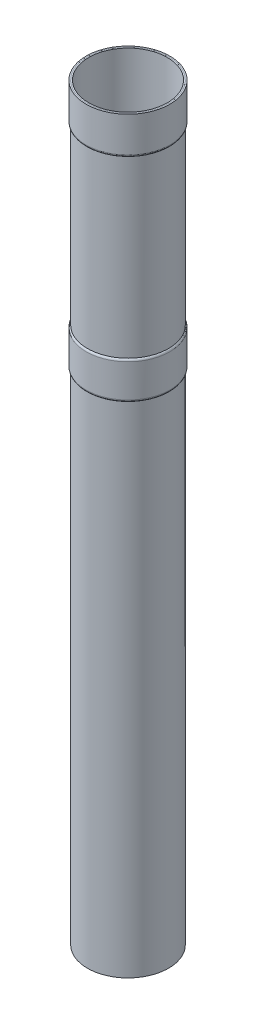
from build123d import *

# Parameters (mm, degrees)
ESBO_O1_R                = 32.5
ESBO_O1_R_2              = 31.5
RESSALTO_EXTRUS_O1_DEPTH = 600
ESBO_O2_R                = 33.5
ESBO_O2_R_2              = 32.5
RESSALTO_EXTRUS_O2_DEPTH = 30
ESBO_O4_R                = 33.5
ESBO_O4_R_2              = 32.5
RESSALTO_EXTRUS_O3_DEPTH = 430
ESBO_O5_R                = 33.5
ESBO_O5_R_2              = 32.5
CORTE_EXTRUS_O1_DEPTH    = 400
FILETE4_R                = 2
FILETE8_R                = 2
FILETE9_R                = 2


with BuildPart() as part:
    # Esboço1 → Ressalto-extrusão1 (new body)
    with BuildSketch(Plane(origin=(0, 0, 0), x_dir=(1, 0, 0), z_dir=(0, 1, 0))):
        with Locations(Location((0, 0, 0), (0, 0, 270))):
            Circle(ESBO_O1_R)
        with Locations(Location((0, 0, 0), (0, 0, 270))):
            Circle(ESBO_O1_R_2, mode=Mode.SUBTRACT)
    extrude(amount=RESSALTO_EXTRUS_O1_DEPTH)

    # Esboço4 → Ressalto-extrusão3 (add)
    with BuildSketch(Plane.XZ):
        with Locations(Location((0, 0, 0), (0, 0, 90))):
            Circle(ESBO_O4_R)
        with Locations(Location((0, 0, 0), (0, 0, 90))):
            Circle(ESBO_O4_R_2, mode=Mode.SUBTRACT)
    extrude(amount=-RESSALTO_EXTRUS_O3_DEPTH)

    # Esboço5 → Corte-extrusão1 (cut)
    with BuildSketch(Plane.XZ):
        with Locations(Location((0, 0, 0), (0, 0, 90))):
            Circle(ESBO_O5_R)
        with Locations(Location((0, 0, 0), (0, 0, 90))):
            Circle(ESBO_O5_R_2, mode=Mode.SUBTRACT)
    extrude(amount=-CORTE_EXTRUS_O1_DEPTH, mode=Mode.SUBTRACT)

    # Filete4
    # the kernel refuses this fillet: 2 mm, written as the material it takes off along each edge
    with BuildSketch(Plane(origin=(0, 400, 0), x_dir=(0, 0, 1), z_dir=(1, 0, 0))) as filete4_piece_1:
        with BuildLine():
            CenterArc((31.5, -1.732050808), FILETE4_R, 0, 60)
            Line((32.5, 0), (32.52, 0.034641016))
            ThreePointArc((32.52, 0.034641016), (33, 0.04), (33.5, 0.04))
            Line((33.5, 0.04), (33.54, 0))
            Line((33.54, 0), (33.54, -1.732050808))
            Line((33.54, -1.732050808), (33.5, -1.732050808))
        make_face()
    revolve(axis=Axis((0, 400, 0), (0, -1, 0)), mode=Mode.SUBTRACT)

    # Filete8
    # the kernel refuses this fillet: 2 mm, written as the material it takes off along each edge
    with BuildSketch(Plane(origin=(0, 430, 0), x_dir=(0, 0, 1), z_dir=(1, 0, 0))) as filete8_piece_1:
        with BuildLine():
            CenterArc((31.5, 1.732050808), FILETE8_R, 300, 60)
            Line((33.5, 1.732050808), (33.54, 1.732050808))
            Line((33.54, 1.732050808), (33.54, 0))
            Line((33.54, 0), (33.5, -0.04))
            ThreePointArc((33.5, -0.04), (33, -0.04), (32.52, -0.034641016))
            Line((32.52, -0.034641016), (32.5, 0))
        make_face()
    revolve(axis=Axis((0, 430, 0), (0, -1, 0)), mode=Mode.SUBTRACT)


with BuildPart() as body_2:
    # Esboço2 → Ressalto-extrusão2 (new body)
    with BuildSketch(Plane(origin=(0, 600, 0), x_dir=(1, 0, 0), z_dir=(0, 1, 0))):
        with Locations(Location((0, 0, 0), (0, 0, 270))):
            Circle(ESBO_O2_R)
        with Locations(Location((0, 0, 0), (0, 0, 270))):
            Circle(ESBO_O2_R_2, mode=Mode.SUBTRACT)
    extrude(amount=-RESSALTO_EXTRUS_O2_DEPTH)

    # Filete9
    # the kernel refuses this fillet: 2 mm, written as the material it takes off along each edge
    with BuildSketch(Plane(origin=(0, 570, 0), x_dir=(0, 0, 1), z_dir=(-1, 0, 0))) as filete9_piece_1:
        with BuildLine():
            CenterArc((31.5, 1.732050808), FILETE9_R, 300, 60)
            Line((32.5, 0), (32.52, -0.034641016))
            ThreePointArc((32.52, -0.034641016), (33, -0.04), (33.5, -0.04))
            Line((33.5, -0.04), (33.54, 0))
            Line((33.54, 0), (33.54, 1.732050808))
            Line((33.54, 1.732050808), (33.5, 1.732050808))
        make_face()
    revolve(axis=Axis((0, 570, 0), (0, 1, 0)), mode=Mode.SUBTRACT)


solid = Compound([part.part, body_2.part])
